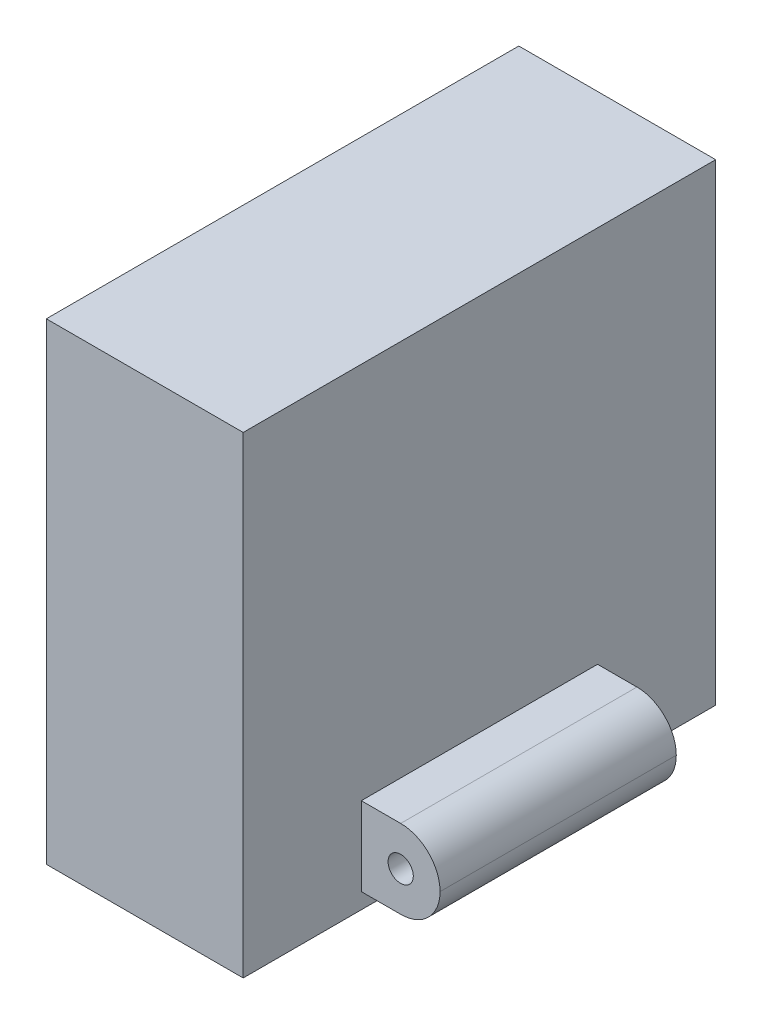
from build123d import *

# Parameters (mm, degrees)
SKETCH1_W           = 25
SKETCH1_H           = 60
BOSS_EXTRUDE1_DEPTH = 60
SKETCH2_W           = 30
SKETCH2_H           = 10
BOSS_EXTRUDE2_DEPTH = 10
SKETCH3_R           = 1.6
CUT_EXTRUDE1_DEPTH  = 83.764726786
FILLET3_R           = 5


with BuildPart() as part:
    # Sketch1 → Boss-Extrude1 (new body)
    with BuildSketch(Plane(origin=(0, 0, 0), x_dir=(1, 0, 0), z_dir=(0, 1, 0))):
        with Locations((12.5, 30)):
            Rectangle(SKETCH1_W, SKETCH1_H)
    extrude(amount=BOSS_EXTRUDE1_DEPTH)

    # Sketch2 → Boss-Extrude2 (add)
    with BuildSketch(Plane(origin=(25, 0, 0), x_dir=(0, 0, -1), z_dir=(1, 0, 0))):
        with Locations((30, 7)):
            Rectangle(SKETCH2_W, SKETCH2_H)
    extrude(amount=BOSS_EXTRUDE2_DEPTH)

    # Sketch3 → Cut-Extrude1 (cut, through all)
    with BuildSketch(Plane(origin=(0, 0, -45), x_dir=(-1, 0, 0), z_dir=(0, 0, -1))):
        with Locations((-30, 7)):
            Circle(SKETCH3_R)
    extrude(amount=-CUT_EXTRUDE1_DEPTH, mode=Mode.SUBTRACT)

    # Fillet3
    fillet3_edges = [part.edges().sort_by_distance(p)[0] for p in [
        (35, 2, -30),
        (35, 12, -30),
    ]]
    fillet(fillet3_edges, radius=FILLET3_R - 0.0001)  # a hair under: the kernel refuses the full size


solid = part.part
